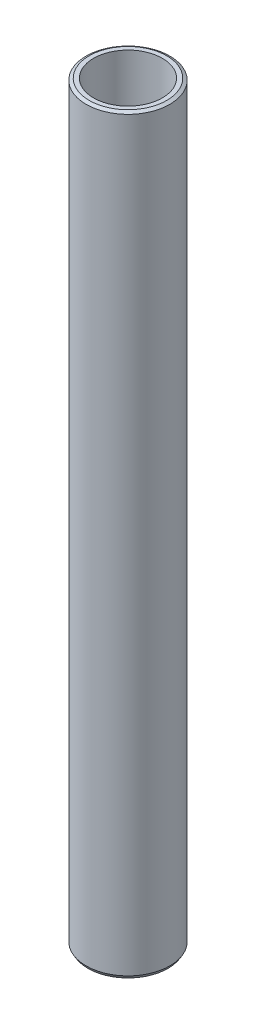
from build123d import *
from OCP.BRepFilletAPI import BRepFilletAPI_MakeChamfer

# Parameters (mm, degrees)
SKETCH1_R           = 30
BOSS_EXTRUDE1_DEPTH = 538.24551276
SKETCH2_R           = 24.64088973
CUT_EXTRUDE1_DEPTH  = 540.915022949
CHAMFER1_SIZE       = 1.285712056
CHAMFER1_SIZE2      = 2.226918605


with BuildPart() as part:
    # Sketch1 → Boss-Extrude1 (new body)
    with BuildSketch(Plane(origin=(0, 0, 0), x_dir=(1, 0, 0), z_dir=(0, 1, 0))):
        Circle(SKETCH1_R)
    extrude(amount=BOSS_EXTRUDE1_DEPTH)

    # Sketch2 → Cut-Extrude1 (cut, through all)
    with BuildSketch(Plane(origin=(0, 0, 0), x_dir=(1, 0, 0), z_dir=(0, 1, 0))):
        Circle(SKETCH2_R)
    extrude(amount=CUT_EXTRUDE1_DEPTH, mode=Mode.SUBTRACT)

    # Chamfer1: one chamfer whose edges measure the first distance from different faces: ONE call of the kernel's chamfer builder (chamfer() names one face for all edges)
    chamfer1_edges_1 = [part.edges().sort_by_distance(p)[0] for p in [
        (-30, 538.24551276, 0),
    ]]
    chamfer1_side_1 = [part.faces().sort_by_distance(p)[0] for p in [
        (-30, 269.12275638, 0),
    ]]
    chamfer1_edges_2 = [part.edges().sort_by_distance(p)[0] for p in [
        (-30, 0, 0),
    ]]
    chamfer1_side_2 = [part.faces().sort_by_distance(p)[0] for p in [
        (-29.151471863, 0, 0),
    ]]
    chamfer1 = BRepFilletAPI_MakeChamfer(part.part.solid().wrapped)
    for e in chamfer1_edges_1:
        chamfer1.Add(CHAMFER1_SIZE, CHAMFER1_SIZE2, e.wrapped, chamfer1_side_1[0].wrapped)  # the first distance lies on this face
    for e in chamfer1_edges_2:
        chamfer1.Add(CHAMFER1_SIZE, CHAMFER1_SIZE2, e.wrapped, chamfer1_side_2[0].wrapped)  # the first distance lies on this face
    add(Compound.cast(chamfer1.Shape()), mode=Mode.REPLACE)


solid = part.part
